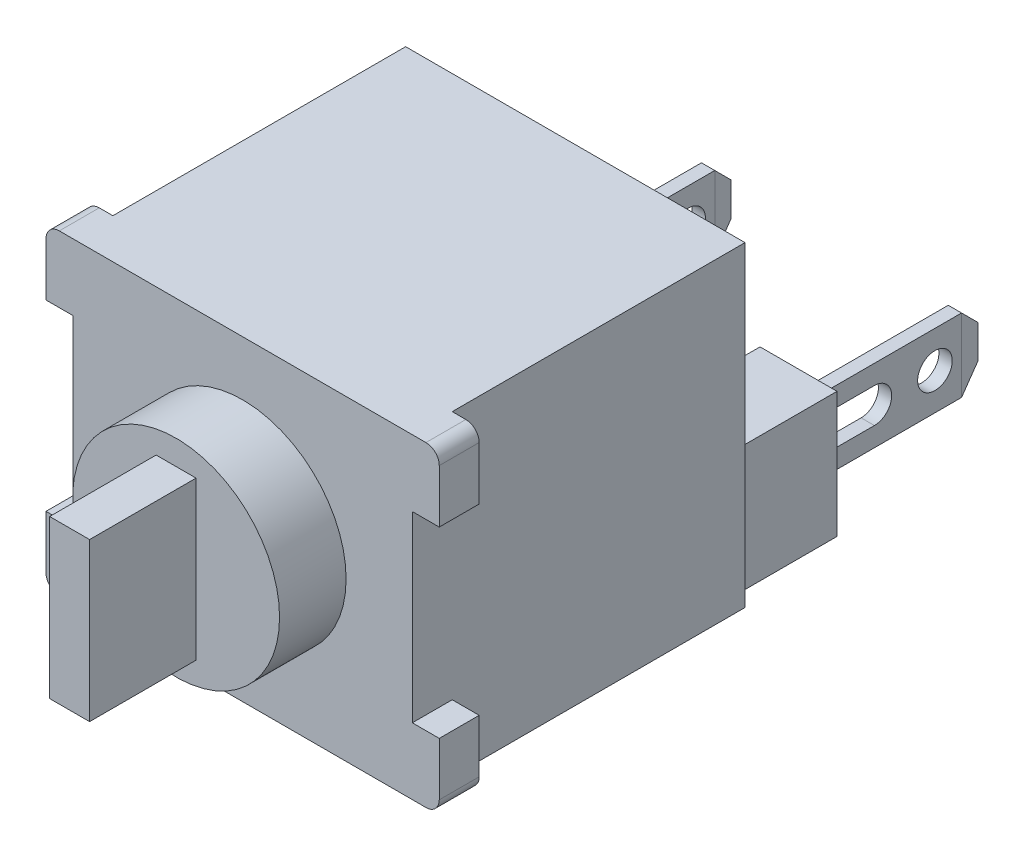
from build123d import *
from OCP.BRepFilletAPI import BRepFilletAPI_MakeChamfer

# Parameters (mm, degrees)
SKETCH1_W                          = 12.954
SKETCH1_H                          = 12.065
EXTRUDE1_DEPTH                     = 12.7
SKETCH2_W                          = 2.939197004
SKETCH2_H                          = 4.798107158
STANDOFF_DEPTH                     = 3.81
SKETCH3_W                          = 0.508
SKETCH3_H                          = 2.794
METAL_DEPTH                        = 6.731
WIRE_HOLE_REACH                    = 20.127
SKETCH4_R                          = 0.6604
CHAMFER1_SIZE                      = 0.762
CHAMFER2_SIZE                      = 0.762
CHAMFER2_SIZE2                     = 0.134361159
CHAMFER1_OF_CONNECTOR_MIRROR_SIZE  = 0.762
CHAMFER2_OF_CONNECTOR_MIRROR_SIZE  = 0.762
CHAMFER2_OF_CONNECTOR_MIRROR_SIZE2 = 0.134361159
SKETCH5_W                          = 1.0287
SKETCH5_H                          = 2.54
TABS_DEPTH                         = 1.524
FILLET1_R                          = 0.508
TEXT_2_DEPTH                       = 0.254
SKETCH7_R                          = 3.9497
PLUNGER_DEPTH                      = 2.54
SKETCH8_W                          = 1.524
SKETCH8_H                          = 6.0198
PLUNGER_I_DEPTH                    = 4.064


with BuildPart() as part:
    # Sketch1 → Extrude1 (new body)
    with BuildSketch(Plane.XY):
        Rectangle(SKETCH1_W, SKETCH1_H)
    extrude(amount=EXTRUDE1_DEPTH)

    # Sketch2 → standoff (add)
    with BuildSketch(Plane(origin=(0, 0, 0), x_dir=(-1, 0, 0), z_dir=(0, 0, -1))):
        with Locations((4.710259285, -3.336304208)):
            Rectangle(SKETCH2_W, SKETCH2_H)
    standoff = extrude(amount=STANDOFF_DEPTH)

    # Sketch3 → metal (add)
    with BuildSketch(Plane(origin=(0, 0, -3.81), x_dir=(-1, 0, 0), z_dir=(0, 0, -1))):
        with Locations((4.710259285, -3.336304208)):
            Rectangle(SKETCH3_W, SKETCH3_H)
    metal = extrude(amount=METAL_DEPTH)

    # Sketch4 → wire hole (cut, up to next)
    with BuildSketch(Plane.ZY.offset(4.964259285), mode=Mode.PRIVATE) as wire_hole_sk1:
        with Locations((-8.763, -3.336304208)):
            Circle(SKETCH4_R)
    wire_hole_tool1 = extrude(wire_hole_sk1.sketch, amount=-WIRE_HOLE_REACH, mode=Mode.PRIVATE) & part.part
    # Sketch4 → wire hole (cut, up to next)
    with BuildSketch(Plane.ZY.offset(4.964259285), mode=Mode.PRIVATE) as wire_hole_sk2:
        with BuildLine():
            Line((-4.4704, -3.996704208), (-6.4516, -3.996704208))
            ThreePointArc((-6.4516, -3.996704208), (-7.112, -3.336304208), (-6.4516, -2.675904208))
            Line((-6.4516, -2.675904208), (-4.4704, -2.675904208))
            ThreePointArc((-4.4704, -2.675904208), (-3.81, -3.336304208), (-4.4704, -3.996704208))
        make_face()
    wire_hole_tool2 = extrude(wire_hole_sk2.sketch, amount=-WIRE_HOLE_REACH, mode=Mode.PRIVATE) & part.part
    wire_hole_1 = wire_hole_tool1.solids().sort_by_distance((-4.964259, -3.336304, -8.763))[0]
    add(wire_hole_1, mode=Mode.SUBTRACT)
    wire_hole_2 = wire_hole_tool2.solids().sort_by_distance((-4.964259, -3.336304, -5.461))[0]
    add(wire_hole_2, mode=Mode.SUBTRACT)
    wire_hole = wire_hole_1 + wire_hole_2  # wire hole as one shape, for the pattern or mirror that repeats it

    # Chamfer1
    chamfer1_edges = [part.edges().sort_by_distance(p)[0] for p in [
        (-4.710259285, -4.733304208, -10.541),
        (-4.710259285, -1.939304208, -10.541),
    ]]
    chamfer(chamfer1_edges, length=CHAMFER1_SIZE)

    # Chamfer2: one chamfer whose edges measure the first distance from different faces: ONE call of the kernel's chamfer builder (chamfer() names one face for all edges)
    chamfer2_edges_1 = [part.edges().sort_by_distance(p)[0] for p in [
        (-4.456259285, -3.336304208, -10.541),
    ]]
    chamfer2_side_1 = [part.faces().sort_by_distance(p)[0] for p in [
        (-4.456259285, -3.336304208, -7.397261172),
    ]]
    chamfer2_edges_2 = [part.edges().sort_by_distance(p)[0] for p in [
        (-4.964259285, -3.336304208, -10.541),
    ]]
    chamfer2_side_2 = [part.faces().sort_by_distance(p)[0] for p in [
        (-4.964259285, -3.336304208, -7.397261172),
    ]]
    chamfer2 = BRepFilletAPI_MakeChamfer(part.part.solid().wrapped)
    for e in chamfer2_edges_1:
        chamfer2.Add(CHAMFER2_SIZE, CHAMFER2_SIZE2, e.wrapped, chamfer2_side_1[0].wrapped)  # the first distance lies on this face
    for e in chamfer2_edges_2:
        chamfer2.Add(CHAMFER2_SIZE, CHAMFER2_SIZE2, e.wrapped, chamfer2_side_2[0].wrapped)  # the first distance lies on this face
    add(Compound.cast(chamfer2.Shape()), mode=Mode.REPLACE)

    # connector mirror: standoff, metal, wire hole across plane
    add(standoff.mirror(Plane(origin=(0, 0, 0), x_dir=(0, 0, 1), z_dir=(1, 0, 0))))
    add(metal.mirror(Plane(origin=(0, 0, 0), x_dir=(0, 0, 1), z_dir=(1, 0, 0))))
    add(wire_hole.mirror(Plane(origin=(0, 0, 0), x_dir=(0, 0, 1), z_dir=(1, 0, 0))), mode=Mode.SUBTRACT)

    # Chamfer1 of connector mirror
    chamfer1_of_connector_mirror_edges = [part.edges().sort_by_distance(p)[0] for p in [
        (4.710259285, -4.733304208, -10.541),
        (4.710259285, -1.939304208, -10.541),
    ]]
    chamfer(chamfer1_of_connector_mirror_edges, length=CHAMFER1_OF_CONNECTOR_MIRROR_SIZE)

    # Chamfer2 of connector mirror: one chamfer whose edges measure the first distance from different faces: ONE call of the kernel's chamfer builder (chamfer() names one face for all edges)
    chamfer2_of_connector_mirror_edges_1 = [part.edges().sort_by_distance(p)[0] for p in [
        (4.456259285, -3.336304208, -10.541),
    ]]
    chamfer2_of_connector_mirror_side_1 = [part.faces().sort_by_distance(p)[0] for p in [
        (4.456259285, -3.336304208, -7.397261172),
    ]]
    chamfer2_of_connector_mirror_edges_2 = [part.edges().sort_by_distance(p)[0] for p in [
        (4.964259285, -3.336304208, -10.541),
    ]]
    chamfer2_of_connector_mirror_side_2 = [part.faces().sort_by_distance(p)[0] for p in [
        (4.964259285, -3.336304208, -7.397261172),
    ]]
    chamfer2_of_connector_mirror = BRepFilletAPI_MakeChamfer(part.part.solid().wrapped)
    for e in chamfer2_of_connector_mirror_edges_1:
        chamfer2_of_connector_mirror.Add(CHAMFER2_OF_CONNECTOR_MIRROR_SIZE, CHAMFER2_OF_CONNECTOR_MIRROR_SIZE2, e.wrapped, chamfer2_of_connector_mirror_side_1[0].wrapped)  # the first distance lies on this face
    for e in chamfer2_of_connector_mirror_edges_2:
        chamfer2_of_connector_mirror.Add(CHAMFER2_OF_CONNECTOR_MIRROR_SIZE, CHAMFER2_OF_CONNECTOR_MIRROR_SIZE2, e.wrapped, chamfer2_of_connector_mirror_side_2[0].wrapped)  # the first distance lies on this face
    add(Compound.cast(chamfer2_of_connector_mirror.Shape()), mode=Mode.REPLACE)

    # Sketch5 → tabs (add)
    with BuildSketch(Plane.XY.offset(12.7)):
        with Locations((6.99135, 4.7625)):
            Rectangle(SKETCH5_W, SKETCH5_H)
        with Locations((-6.99135, 4.7625)):
            Rectangle(SKETCH5_W, SKETCH5_H)
        with Locations((6.99135, -4.7625)):
            Rectangle(SKETCH5_W, SKETCH5_H)
        with Locations((-6.99135, -4.7625)):
            Rectangle(SKETCH5_W, SKETCH5_H)
    extrude(amount=-TABS_DEPTH)

    # Fillet1
    fillet1_edges = [part.edges().sort_by_distance(p)[0] for p in [
        (-7.5057, -6.0325, 11.938),
        (-7.5057, 6.0325, 11.938),
        (7.5057, 6.0325, 11.938),
        (7.5057, -6.0325, 11.938),
    ]]
    fillet(fillet1_edges, radius=FILLET1_R)

    # Sketch6 → text 2 (add)
    # profile 1 of 5: a face of its own
    with BuildSketch(Plane(origin=(0, 0, 0), x_dir=(-1, 0, 0), z_dir=(0, 0, -1))):
        with BuildLine():
            Line((-5.383171322, 1.004934785), (-5.211395681, 1.10791876))
            add(Edge.make_bspline(
                [(-5.211395681, 1.10791876), (-5.195419379, 1.081175094), (-5.1648094, 1.029935262), (-5.113747354, 0.960697451), (-5.060838189, 0.901849479), (-5.005690096, 0.853733689), (-4.948639694, 0.815852049), (-4.889314552, 0.789028354), (-4.827914589, 0.772298622), (-4.786128645, 0.770266572), (-4.765267476, 0.769252093)],
                knots=[0, 0, 0, 0, 1.272034388, 2.437168799, 3.508375237, 4.49857839, 5.41946034, 6.295179144, 7.148887113, 8, 8, 8, 8], degree=3))
            add(Edge.make_bspline(
                [(-4.765267476, 0.769252093), (-4.747451561, 0.769748291), (-4.712131469, 0.770732006), (-4.66013419, 0.780184175), (-4.609635041, 0.794705502), (-4.561674826, 0.815502111), (-4.516915315, 0.840663198), (-4.477664799, 0.871053893), (-4.443732656, 0.905078981), (-4.41597605, 0.943038283), (-4.394680669, 0.98386241), (-4.37831316, 1.025765705), (-4.369230077, 1.069406428), (-4.367861813, 1.098789417), (-4.367171322, 1.113617478)],
                knots=[0, 0, 0, 0, 1.095163259, 2.171163733, 3.241058638, 4.321873601, 5.38011039, 6.391990106, 7.366004449, 8.327778327, 9.272591725, 10.192022065, 11.087607919, 12, 12, 12, 12], degree=3))
            add(Edge.make_bspline(
                [(-4.367171322, 1.113617478), (-4.368027265, 1.130535822), (-4.369767271, 1.164928345), (-4.384474005, 1.215670086), (-4.407609339, 1.265885201), (-4.428952679, 1.296946507), (-4.440033501, 1.313072606)],
                knots=[0, 0, 0, 0, 0.938893495, 1.908633276, 2.914225137, 4, 4, 4, 4], degree=3))
            add(Edge.make_bspline(
                [(-4.440033501, 1.313072606), (-4.449131412, 1.324711219), (-4.468231338, 1.349145031), (-4.501067014, 1.385515065), (-4.539597284, 1.423030673), (-4.582503576, 1.463124388), (-4.631348844, 1.503931475), (-4.684603218, 1.547397858), (-4.74362635, 1.591870545), (-4.7850208, 1.621695988), (-4.806379655, 1.637085426)],
                knots=[0, 0, 0, 0, 0.722233717, 1.516239348, 2.393582979, 3.351407094, 4.387010283, 5.505090956, 6.712668013, 8, 8, 8, 8], degree=3))
            add(Edge.make_bspline(
                [(-4.806379655, 1.637085426), (-4.827758615, 1.652312995), (-4.868633559, 1.681426946), (-4.925795799, 1.724635559), (-4.976911899, 1.764139886), (-5.021754665, 1.800311815), (-5.060304373, 1.833156253), (-5.0928648, 1.8623578), (-5.118606499, 1.888706198), (-5.132920825, 1.905799), (-5.139347604, 1.913473247)],
                knots=[0, 0, 0, 0, 1.452282411, 2.77665338, 3.964542531, 5.026858415, 5.96415736, 6.766646006, 7.446254459, 8, 8, 8, 8], degree=3))
            add(Edge.make_bspline(
                [(-5.139347604, 1.913473247), (-5.148330522, 1.92543362), (-5.165996635, 1.9489553), (-5.18931587, 1.985719903), (-5.209136093, 2.023354439), (-5.224673538, 2.061960038), (-5.237757423, 2.100994716), (-5.246557684, 2.140967782), (-5.252068118, 2.181699872), (-5.252632426, 2.209110681), (-5.252914912, 2.222832221)],
                knots=[0, 0, 0, 0, 1.068054152, 2.10047183, 3.106115577, 4.101338837, 5.06977816, 6.043150881, 7.020423561, 8, 8, 8, 8], degree=3))
            add(Edge.make_bspline(
                [(-5.252914912, 2.222832221), (-5.252157145, 2.24433065), (-5.250657807, 2.286867995), (-5.237977827, 2.349007037), (-5.21796385, 2.408333551), (-5.189925218, 2.464260191), (-5.153780378, 2.515330726), (-5.111952543, 2.562132613), (-5.062132846, 2.601477116), (-5.007470523, 2.635853945), (-4.947638938, 2.662761065), (-4.884942505, 2.683058411), (-4.819281576, 2.6945591), (-4.774807985, 2.696209528), (-4.752241835, 2.697046965)],
                knots=[0, 0, 0, 0, 1.005424448, 1.989358655, 2.955360095, 3.929531133, 4.905563448, 5.876582895, 6.856512386, 7.866279853, 8.892233794, 9.918561126, 10.94386622, 12, 12, 12, 12], degree=3))
            add(Edge.make_bspline(
                [(-4.752241835, 2.697046965), (-4.728296689, 2.696221072), (-4.680677435, 2.694578635), (-4.610631948, 2.680298011), (-4.543192355, 2.656668364), (-4.488941865, 2.629852549), (-4.446483073, 2.603069967), (-4.414103018, 2.578674457), (-4.381290601, 2.550589251), (-4.347781147, 2.51873954), (-4.314142456, 2.482833084), (-4.279875126, 2.443115792), (-4.244899025, 2.399830386), (-4.22239848, 2.368929762), (-4.21086363, 2.353088631)],
                knots=[0, 0, 0, 0, 1.286793592, 2.559021753, 3.825965368, 5.121522368, 5.803751409, 6.523245864, 7.299691795, 8.125521123, 9.008227632, 9.944561021, 10.946284179, 12, 12, 12, 12], degree=3))
            Line((-4.21086363, 2.353088631), (-4.375719399, 2.228123888))
            add(Edge.make_bspline(
                [(-4.375719399, 2.228123888), (-4.385673837, 2.24094795), (-4.404843759, 2.265644097), (-4.433947506, 2.3002295), (-4.461378721, 2.331822154), (-4.488404553, 2.359262936), (-4.513597656, 2.384054575), (-4.538049607, 2.405280125), (-4.561408522, 2.423147557), (-4.590853312, 2.442215589), (-4.627845998, 2.461116965), (-4.674282735, 2.477111173), (-4.722810538, 2.486722569), (-4.755862255, 2.487993374), (-4.772594399, 2.488636708)],
                knots=[0, 0, 0, 0, 1.181633172, 2.275549214, 3.290209073, 4.226197932, 5.078386478, 5.862611352, 6.581680152, 7.217281963, 8.414376989, 9.595101626, 10.782541182, 12, 12, 12, 12], degree=3))
            add(Edge.make_bspline(
                [(-4.772594399, 2.488636708), (-4.793585843, 2.48793323), (-4.834065865, 2.486576638), (-4.891536768, 2.471760464), (-4.943262155, 2.448432024), (-4.987706387, 2.415737157), (-5.024710255, 2.377000855), (-5.051477767, 2.332425245), (-5.06758872, 2.283203004), (-5.069554697, 2.248867048), (-5.070555937, 2.231380298)],
                knots=[0, 0, 0, 0, 1.14458467, 2.207223713, 3.21896685, 4.227309161, 5.202851033, 6.127160689, 7.046193047, 8, 8, 8, 8], degree=3))
            add(Edge.make_bspline(
                [(-5.070555937, 2.231380298), (-5.070327699, 2.220493725), (-5.06987085, 2.198702778), (-5.063499196, 2.166509267), (-5.055313528, 2.134397084), (-5.042342035, 2.102510601), (-5.024434133, 2.070292162), (-5.000917985, 2.03718697), (-4.971301113, 2.002903236), (-4.948614117, 1.980605012), (-4.936636066, 1.968832221)],
                knots=[0, 0, 0, 0, 0.858281714, 1.717966888, 2.583508476, 3.4729293, 4.427298488, 5.488583878, 6.674047936, 8, 8, 8, 8], degree=3))
            add(Edge.make_bspline(
                [(-4.936636066, 1.968832221), (-4.932188092, 1.964862839), (-4.921620724, 1.955432497), (-4.902301672, 1.939993778), (-4.876789739, 1.920949426), (-4.845751112, 1.89738559), (-4.80861349, 1.870051438), (-4.765372787, 1.839296472), (-4.716511006, 1.804122286), (-4.681838168, 1.779530708), (-4.663504655, 1.766527734)],
                knots=[0, 0, 0, 0, 0.420754252, 0.999615792, 1.744751191, 2.668019286, 3.750313428, 4.999500688, 6.413464383, 8, 8, 8, 8], degree=3))
            add(Edge.make_bspline(
                [(-4.663504655, 1.766527734), (-4.641451119, 1.75047995), (-4.598747504, 1.719405642), (-4.537986303, 1.672718595), (-4.482893669, 1.627057948), (-4.433276175, 1.582715292), (-4.388643638, 1.540026982), (-4.349491225, 1.498479444), (-4.315419995, 1.458370334), (-4.278739946, 1.406947627), (-4.241259521, 1.343792438), (-4.209071766, 1.2664149), (-4.188775948, 1.18873658), (-4.186121857, 1.136527628), (-4.184812348, 1.110768119)],
                knots=[0, 0, 0, 0, 1.163667725, 2.253281268, 3.268753668, 4.215851969, 5.092017293, 5.902905408, 6.650798638, 7.335211899, 8.59617414, 9.77448103, 10.901945474, 12, 12, 12, 12], degree=3))
            add(Edge.make_bspline(
                [(-4.184812348, 1.110768119), (-4.185193863, 1.092550736), (-4.185949486, 1.056469741), (-4.194635365, 1.003489651), (-4.207361296, 0.9520331), (-4.22654177, 0.902736134), (-4.249952244, 0.854696889), (-4.279657905, 0.809175502), (-4.314090253, 0.765164473), (-4.353588713, 0.723837372), (-4.396809877, 0.685899238), (-4.442491382, 0.652151165), (-4.490707997, 0.624011842), (-4.541198156, 0.601049753), (-4.593973455, 0.583090636), (-4.649016146, 0.570078365), (-4.706416959, 0.562092192), (-4.745431639, 0.561263275), (-4.765267476, 0.560841837)],
                knots=[0, 0, 0, 0, 0.983748083, 1.948392443, 2.894712957, 3.844097841, 4.80183111, 5.778335162, 6.776009319, 7.81870978, 8.863265674, 9.881300176, 10.883814829, 11.87499822, 12.874611388, 13.892143829, 14.928324115, 16, 16, 16, 16], degree=3))
            add(Edge.make_bspline(
                [(-4.765267476, 0.560841837), (-4.780615081, 0.561138614), (-4.811117003, 0.561728431), (-4.856232908, 0.566942706), (-4.900437378, 0.574320087), (-4.943175727, 0.586032576), (-4.98499859, 0.600243209), (-5.02572407, 0.617740664), (-5.065371905, 0.63870928), (-5.104164284, 0.662683991), (-5.142002548, 0.690584944), (-5.178531793, 0.723081557), (-5.214950566, 0.759277576), (-5.250183935, 0.800155937), (-5.284944572, 0.845056219), (-5.318547122, 0.89439851), (-5.351687137, 0.947914048), (-5.372480574, 0.985572864), (-5.383171322, 1.004934785)],
                knots=[0, 0, 0, 0, 0.915332311, 1.819136955, 2.706846663, 3.586547465, 4.459518054, 5.340707479, 6.227863349, 7.133153174, 8.059268498, 9.028702269, 10.047606654, 11.120612155, 12.245963614, 13.433783089, 14.680604001, 16, 16, 16, 16], degree=3))
        make_face()
    # profile 2 of 5: a face of its own
    with BuildSketch(Plane(origin=(0, 0, 0), x_dir=(-1, 0, 0), z_dir=(0, 0, -1))):
        Polygon((-2.934350809, 2.644944401), (-1.996504655, 0.612944401), (-2.19473863, 0.612944401), (-2.495142476, 1.264226452), (-3.416299527, 1.264226452), (-3.72525145, 0.612944401), (-3.924299527, 0.612944401), (-2.960402091, 2.644944401), align=None)
        Polygon((-2.949411707, 2.248883503), (-3.317386066, 1.472636708), (-2.591206578, 1.472636708), align=None, mode=Mode.SUBTRACT)
    # profile 3 of 5: a face of its own
    with BuildSketch(Plane(origin=(0, 0, 0), x_dir=(-1, 0, 0), z_dir=(0, 0, -1))):
        Polygon((-1.631786707, 0.612944401), (-1.631786707, 2.644944401), (-1.593523886, 2.644944401), (-0.251068758, 1.045639913), (-0.251068758, 2.644944401), (-0.068709784, 2.644944401), (-0.068709784, 0.612944401), (-0.110229014, 0.612944401), (-1.449427732, 2.208585426), (-1.449427732, 0.612944401), align=None)
    # profile 4 of 5: a face of its own
    with BuildSketch(Plane(origin=(0, 0, 0), x_dir=(-1, 0, 0), z_dir=(0, 0, -1))):
        Polygon((0.322059447, 2.644944401), (0.510524191, 2.644944401), (0.908213293, 1.154729657), (1.499658806, 2.644944401), (1.52611714, 2.644944401), (2.106572268, 1.164905939), (2.506296627, 2.644944401), (2.692726114, 2.644944401), (2.144835088, 0.612944401), (2.118783806, 0.612944401), (1.507392781, 2.167066196), (0.888674832, 0.612944401), (0.86262355, 0.612944401), align=None)
    # profile 5 of 5: a face of its own
    with BuildSketch(Plane(origin=(0, 0, 0), x_dir=(-1, 0, 0), z_dir=(0, 0, -1))):
        Polygon((3.891085088, 2.644944401), (4.828931242, 0.612944401), (4.630697268, 0.612944401), (4.330293422, 1.264226452), (3.40913637, 1.264226452), (3.100184447, 0.612944401), (2.90113637, 0.612944401), (3.865033806, 2.644944401), align=None)
        Polygon((3.876024191, 2.248883503), (3.508049832, 1.472636708), (4.234229319, 1.472636708), align=None, mode=Mode.SUBTRACT)
    extrude(amount=TEXT_2_DEPTH)

    # Sketch7 → plunger (add)
    with BuildSketch(Plane.XY.offset(12.7)):
        Circle(SKETCH7_R)
    extrude(amount=PLUNGER_DEPTH)

    # Sketch8 → plunger I (add)
    with BuildSketch(Plane.XY.offset(15.24)):
        Rectangle(SKETCH8_W, SKETCH8_H)
    extrude(amount=PLUNGER_I_DEPTH)


solid = part.part
